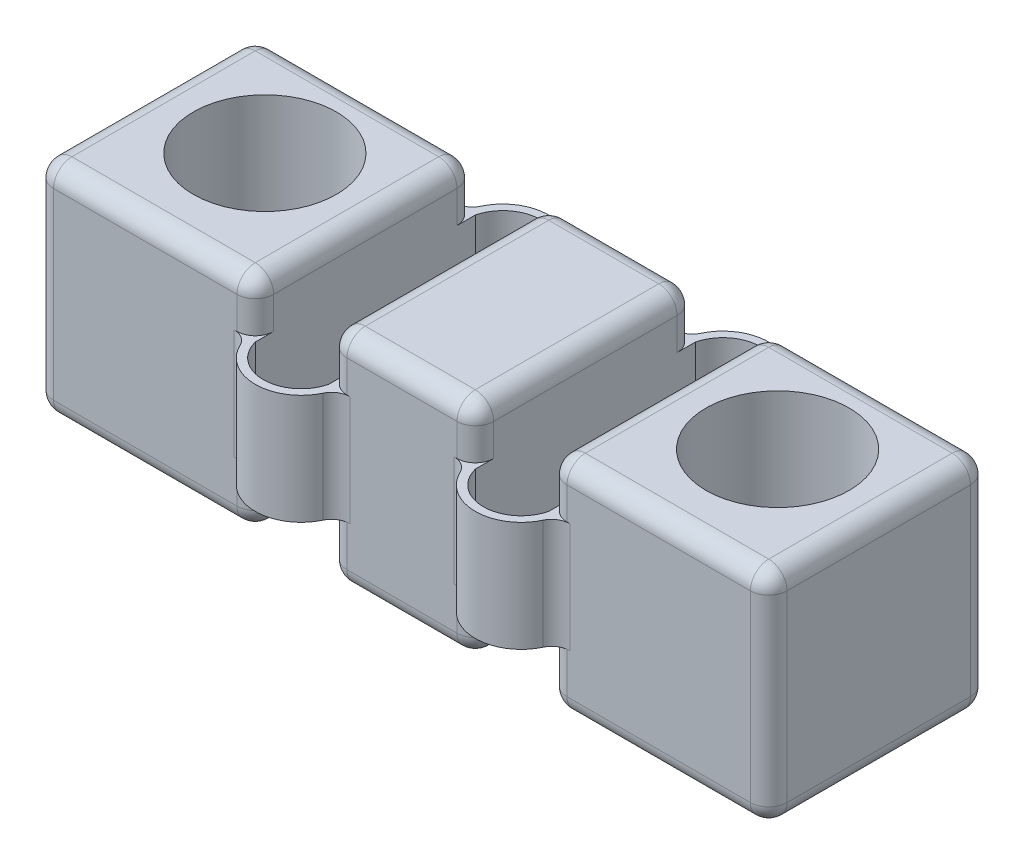
from build123d import *

# Parameters (mm, degrees)
SKETCH_1_W           = 20
SKETCH_1_H           = 6
EXTRUDE_3_DEPTH      = 8
CUT_EXTRUDE_4_DEPTH  = 5
CUT_EXTRUDE_6_DEPTH  = 14.865839901
CUT_EXTRUDE_7_DEPTH  = 14.784466481
HOLE_WIZARD_M3_5_1_D = 3.9
FILLET_4_R           = 0.5
FILLET_5_R           = 0.5
FILLET_6_R           = 0.5
FILLET_7_R           = 0.5
FILLET_8_R           = 0.5
FILLET_9_R           = 0.5
FILLET_10_R          = 0.5
FILLET_11_R          = 0.5
FILLET_12_R          = 0.5
FILLET_13_R          = 0.5
FILLET_14_R          = 0.5
FILLET_15_R          = 0.5
FILLET_16_R          = 0.5
FILLET_18_R          = 0.5
FILLET_19_R          = 0.5
FILLET_20_R          = 0.5


with BuildPart() as part:
    # 草图1 → 凸台-拉伸3 (new body)
    with BuildSketch(Plane.XY):
        with Locations((-0.337837838, 1.375)):
            Rectangle(SKETCH_1_W, SKETCH_1_H)
    extrude(amount=EXTRUDE_3_DEPTH)

    # 草图4 → 切除-拉伸4 (cut, symmetric)
    with BuildSketch(Plane(origin=(0, 0, 0), x_dir=(1, 0, 0), z_dir=(0, 1, 0))):
        with BuildLine():
            Line((-10.337837838, -1), (-4.562582709, -1))
            ThreePointArc((-4.562582709, -1), (-4.477957321, -0.737527987), (-4.337837838, -0.5))
            Line((-4.337837838, -0.5), (-4.337837838, 0))
            Line((-4.337837838, 0), (-10.337837838, 0))
            Line((-10.337837838, 0), (-10.337837838, -1))
        make_face()
        with BuildLine():
            Line((-10.337837838, -8), (-4.337837838, -8))
            Line((-4.337837838, -8), (-4.337837838, -7.5))
            ThreePointArc((-4.337837838, -7.5), (-4.477957321, -7.262472013), (-4.562582709, -7))
            Line((-4.562582709, -7), (-10.337837838, -7))
            Line((-10.337837838, -7), (-10.337837838, -8))
        make_face()
        with BuildLine():
            Line((-4.337837838, -8), (-3.337837838, -8))
            ThreePointArc((-3.337837838, -8), (-3.896854832, -7.868033989), (-4.337837838, -7.5))
            Line((-4.337837838, -7.5), (-4.337837838, -8))
        make_face()
        with BuildLine():
            Line((-3.337837838, -8), (-2.337837838, -8))
            Line((-2.337837838, -8), (-2.337837838, -7.5))
            ThreePointArc((-2.337837838, -7.5), (-2.778820843, -7.868033989), (-3.337837838, -8))
        make_face()
        with BuildLine():
            Line((-0.337837838, -8), (1.662162162, -8))
            Line((1.662162162, -8), (1.662162162, -7.5))
            ThreePointArc((1.662162162, -7.5), (1.522042679, -7.262472013), (1.437417291, -7))
            Line((1.437417291, -7), (-2.113092966, -7))
            ThreePointArc((-2.113092966, -7), (-2.197718355, -7.262472013), (-2.337837838, -7.5))
            Line((-2.337837838, -7.5), (-2.337837838, -8))
            Line((-2.337837838, -8), (-0.337837838, -8))
        make_face()
        with BuildLine():
            Line((1.662162162, -8), (2.662162162, -8))
            ThreePointArc((2.662162162, -8), (2.103145168, -7.868033989), (1.662162162, -7.5))
            Line((1.662162162, -7.5), (1.662162162, -8))
        make_face()
        with BuildLine():
            Line((2.662162162, -8), (3.662162162, -8))
            Line((3.662162162, -8), (3.662162162, -7.5))
            ThreePointArc((3.662162162, -7.5), (3.221179157, -7.868033989), (2.662162162, -8))
        make_face()
        with BuildLine():
            Line((3.662162162, -8), (9.662162162, -8))
            Line((9.662162162, -8), (9.662162162, -7))
            Line((9.662162162, -7), (3.886907034, -7))
            ThreePointArc((3.886907034, -7), (3.802281645, -7.262472013), (3.662162162, -7.5))
            Line((3.662162162, -7.5), (3.662162162, -8))
        make_face()
        with BuildLine():
            ThreePointArc((3.662162162, -0.5), (3.802281645, -0.737527987), (3.886907034, -1))
            Line((3.886907034, -1), (9.662162162, -1))
            Line((9.662162162, -1), (9.662162162, 0))
            Line((9.662162162, 0), (3.662162162, 0))
            Line((3.662162162, 0), (3.662162162, -0.5))
        make_face()
        with BuildLine():
            ThreePointArc((2.662162162, 0), (3.221179157, -0.131966011), (3.662162162, -0.5))
            Line((3.662162162, -0.5), (3.662162162, 0))
            Line((3.662162162, 0), (2.662162162, 0))
        make_face()
        with BuildLine():
            Line((1.662162162, 0), (1.662162162, -0.5))
            ThreePointArc((1.662162162, -0.5), (2.103145168, -0.131966011), (2.662162162, 0))
            Line((2.662162162, 0), (1.662162162, 0))
        make_face()
        with BuildLine():
            Line((-2.113092966, -1), (1.437417291, -1))
            ThreePointArc((1.437417291, -1), (1.522042679, -0.737527987), (1.662162162, -0.5))
            Line((1.662162162, -0.5), (1.662162162, 0))
            Line((1.662162162, 0), (-2.337837838, 0))
            Line((-2.337837838, 0), (-2.337837838, -0.5))
            ThreePointArc((-2.337837838, -0.5), (-2.197718355, -0.737527987), (-2.113092966, -1))
        make_face()
        with BuildLine():
            ThreePointArc((-3.337837838, 0), (-2.778820843, -0.131966011), (-2.337837838, -0.5))
            Line((-2.337837838, -0.5), (-2.337837838, 0))
            Line((-2.337837838, 0), (-3.337837838, 0))
        make_face()
        with BuildLine():
            ThreePointArc((-4.337837838, -0.5), (-3.896854832, -0.131966011), (-3.337837838, 0))
            Line((-3.337837838, 0), (-4.337837838, 0))
            Line((-4.337837838, 0), (-4.337837838, -0.5))
        make_face()
        with BuildLine():
            Line((-4.337837838, -1), (-2.337837838, -1))
            ThreePointArc((-2.337837838, -1), (-3.337837838, -0.219223594), (-4.337837838, -1))
        make_face()
        with BuildLine():
            ThreePointArc((-4.337837838, -7), (-3.337837838, -7.780776406), (-2.337837838, -7))
            Line((-2.337837838, -7), (-4.337837838, -7))
        make_face()
        with BuildLine():
            ThreePointArc((1.662162162, -7), (2.662162162, -7.780776406), (3.662162162, -7))
            Line((3.662162162, -7), (2.662162162, -7))
            Line((2.662162162, -7), (1.662162162, -7))
        make_face()
        with BuildLine():
            Line((1.662162162, -1), (3.662162162, -1))
            ThreePointArc((3.662162162, -1), (2.662162162, -0.219223594), (1.662162162, -1))
        make_face()
        with BuildLine():
            ThreePointArc((-4.337837838, -1.5), (-3.337837838, -2.280776406), (-2.337837838, -1.5))
            Line((-2.337837838, -1.5), (-2.337837838, -1))
            Line((-2.337837838, -1), (-4.337837838, -1))
            Line((-4.337837838, -1), (-4.337837838, -1.5))
        make_face()
        with BuildLine():
            ThreePointArc((-4.337837838, -2), (-3.337837838, -2.5), (-2.337837838, -2))
            Line((-2.337837838, -2), (-2.337837838, -1.5))
            ThreePointArc((-2.337837838, -1.5), (-3.337837838, -2.280776406), (-4.337837838, -1.5))
            Line((-4.337837838, -1.5), (-4.337837838, -2))
        make_face()
        with BuildLine():
            ThreePointArc((-4.337837838, -6), (-3.337837838, -5.5), (-2.337837838, -6))
            Line((-2.337837838, -6), (-2.337837838, -2))
            ThreePointArc((-2.337837838, -2), (-3.337837838, -2.5), (-4.337837838, -2))
            Line((-4.337837838, -2), (-4.337837838, -6))
        make_face()
        with BuildLine():
            ThreePointArc((-4.337837838, -6.5), (-3.337837838, -5.719223594), (-2.337837838, -6.5))
            Line((-2.337837838, -6.5), (-2.337837838, -6))
            ThreePointArc((-2.337837838, -6), (-3.337837838, -5.5), (-4.337837838, -6))
            Line((-4.337837838, -6), (-4.337837838, -6.5))
        make_face()
        with BuildLine():
            Line((-4.337837838, -7), (-2.337837838, -7))
            Line((-2.337837838, -7), (-2.337837838, -6.5))
            ThreePointArc((-2.337837838, -6.5), (-3.337837838, -5.719223594), (-4.337837838, -6.5))
            Line((-4.337837838, -6.5), (-4.337837838, -7))
        make_face()
        with BuildLine():
            ThreePointArc((1.662162162, -6), (2.662162162, -5.5), (3.662162162, -6))
            Line((3.662162162, -6), (3.662162162, -2))
            ThreePointArc((3.662162162, -2), (2.662162162, -2.5), (1.662162162, -2))
            Line((1.662162162, -2), (1.662162162, -6))
        make_face()
        with BuildLine():
            ThreePointArc((1.662162162, -6.5), (2.662162162, -5.719223594), (3.662162162, -6.5))
            Line((3.662162162, -6.5), (3.662162162, -6))
            ThreePointArc((3.662162162, -6), (2.662162162, -5.5), (1.662162162, -6))
            Line((1.662162162, -6), (1.662162162, -6.5))
        make_face()
        with BuildLine():
            Line((2.662162162, -7), (3.662162162, -7))
            Line((3.662162162, -7), (3.662162162, -6.5))
            ThreePointArc((3.662162162, -6.5), (2.662162162, -5.719223594), (1.662162162, -6.5))
            Line((1.662162162, -6.5), (1.662162162, -7))
            Line((1.662162162, -7), (2.662162162, -7))
        make_face()
        with BuildLine():
            ThreePointArc((1.662162162, -2), (2.662162162, -2.5), (3.662162162, -2))
            Line((3.662162162, -2), (3.662162162, -1.5))
            ThreePointArc((3.662162162, -1.5), (2.662162162, -2.280776406), (1.662162162, -1.5))
            Line((1.662162162, -1.5), (1.662162162, -2))
        make_face()
        with BuildLine():
            ThreePointArc((1.662162162, -1.5), (2.662162162, -2.280776406), (3.662162162, -1.5))
            Line((3.662162162, -1.5), (3.662162162, -1))
            Line((3.662162162, -1), (1.662162162, -1))
            Line((1.662162162, -1), (1.662162162, -1.5))
        make_face()
    extrude(amount=CUT_EXTRUDE_4_DEPTH, both=True, mode=Mode.SUBTRACT)

    # 草图5 → 切除-拉伸6 (cut, through all)
    with BuildSketch(Plane(origin=(0, 3, 0), x_dir=(1, 0, 0), z_dir=(0, 1, 0))):
        with BuildLine():
            Line((-4.562582709, -7), (-4.337837838, -7))
            ThreePointArc((-4.337837838, -7), (-3.337837838, -7.780776406), (-2.337837838, -7))
            Line((-2.337837838, -7), (-2.113092966, -7))
            ThreePointArc((-2.113092966, -7), (-3.337837838, -8), (-4.562582709, -7))
        make_face()
        with BuildLine():
            Line((-4.562582709, -1), (-4.337837838, -1))
            ThreePointArc((-4.337837838, -1), (-3.337837838, -0.219223594), (-2.337837838, -1))
            Line((-2.337837838, -1), (-2.113092966, -1))
            ThreePointArc((-2.113092966, -1), (-3.337837838, 0), (-4.562582709, -1))
        make_face()
        with BuildLine():
            Line((1.437417291, -1), (1.662162162, -1))
            ThreePointArc((1.662162162, -1), (2.662162162, -0.219223594), (3.662162162, -1))
            Line((3.662162162, -1), (3.886907034, -1))
            ThreePointArc((3.886907034, -1), (2.662162162, 0), (1.437417291, -1))
        make_face()
        with BuildLine():
            Line((1.437417291, -7), (1.662162162, -7))
            ThreePointArc((1.662162162, -7), (2.662162162, -7.780776406), (3.662162162, -7))
            Line((3.662162162, -7), (3.886907034, -7))
            ThreePointArc((3.886907034, -7), (2.662162162, -8), (1.437417291, -7))
        make_face()
    extrude(amount=CUT_EXTRUDE_6_DEPTH, mode=Mode.SUBTRACT)

    # 草图7 → 切除-拉伸7 (cut, through all)
    with BuildSketch(Plane(origin=(0, 0, 0), x_dir=(1, 0, 0), z_dir=(0, 1, 0))):
        with BuildLine():
            Line((-4.562582709, -7), (-4.337837838, -7))
            ThreePointArc((-4.337837838, -7), (-3.337837838, -7.780776406), (-2.337837838, -7))
            Line((-2.337837838, -7), (-2.113092966, -7))
            ThreePointArc((-2.113092966, -7), (-3.337837838, -8), (-4.562582709, -7))
        make_face()
        with BuildLine():
            Line((1.437417291, -7), (1.662162162, -7))
            ThreePointArc((1.662162162, -7), (2.662162162, -7.780776406), (3.662162162, -7))
            Line((3.662162162, -7), (3.886907034, -7))
            ThreePointArc((3.886907034, -7), (2.662162162, -8), (1.437417291, -7))
        make_face()
        with BuildLine():
            Line((1.437417291, -1), (1.662162162, -1))
            ThreePointArc((1.662162162, -1), (2.662162162, -0.219223594), (3.662162162, -1))
            Line((3.662162162, -1), (3.886907034, -1))
            ThreePointArc((3.886907034, -1), (2.662162162, 0), (1.437417291, -1))
        make_face()
        with BuildLine():
            Line((-4.562582709, -1), (-4.337837838, -1))
            ThreePointArc((-4.337837838, -1), (-3.337837838, -0.219223594), (-2.337837838, -1))
            Line((-2.337837838, -1), (-2.113092966, -1))
            ThreePointArc((-2.113092966, -1), (-3.337837838, 0), (-4.562582709, -1))
        make_face()
    extrude(amount=-CUT_EXTRUDE_7_DEPTH, mode=Mode.SUBTRACT)

    # M3.5 间隙孔1 (through all)
    with Locations(Plane(origin=(0, 4.375, 0), x_dir=(1, 0, 0), z_dir=(0, 1, 0))):
        with Locations((-7.291168359, -3.784879217), (6.689336507, -3.784879217)):
            Hole(HOLE_WIZARD_M3_5_1_D / 2)

    # 圆角4
    fillet_4_edges = [part.edges().sort_by_distance(p)[0] for p in [
        (-10.337837838, 1.375, 1),
        (-10.337837838, 4.375, 4),
        (-7.337837838, 4.375, 1),
        (-10.337837838, 1.375, 7),
    ]]
    fillet(fillet_4_edges, radius=FILLET_4_R)

    # 圆角5
    # the kernel refuses this fillet: 0.5 mm, written as the material it takes off along each edge
    with BuildSketch(Plane(origin=(-9.837837838, 3.875, 6.5), x_dir=(0, 0, 1), z_dir=(0, 1, 0))) as fillet_5_piece_1_section:
        Polygon((0, 0), (FILLET_5_R, 0), (FILLET_5_R, -FILLET_5_R), (0, -FILLET_5_R), align=None)
    fillet_5_piece_1 = extrude(amount=FILLET_5_R, mode=Mode.PRIVATE)
    fillet_5_piece_1 = fillet_5_piece_1 - Plane(origin=(-9.837837838, 3.875, 6.5), x_dir=(0.7071067811865475, 0, -0.7071067811865475), z_dir=(0, 1, 0)) * Sphere(FILLET_5_R, mode=Mode.PRIVATE)
    add(fillet_5_piece_1, mode=Mode.SUBTRACT)
    with BuildSketch(Plane(origin=(-9.837837838, -1.625, 7), x_dir=(0, 1, 0), z_dir=(1, 0, 0)), Plane(origin=(-9.837837838, 4.375, 7), x_dir=(0, 0, -1), z_dir=(1, 0, 0)), Plane(origin=(-3.087837838, -1.625, 1), x_dir=(0, 1, 0), z_dir=(-1, 0, 0))) as fillet_5_piece_2:
        with BuildLine():
            CenterArc((FILLET_5_R, -FILLET_5_R), FILLET_5_R, 90, 90)
            Line((0, -FILLET_5_R), (0, 0))
            Line((0, 0), (FILLET_5_R, 0))
        make_face()
    extrude(amount=6.75, mode=Mode.SUBTRACT)
    with BuildSketch(Plane(origin=(-10.337837838, -1.625, 1.5), x_dir=(1, 0, 0), z_dir=(0, 0, 1))) as fillet_5_piece_3:
        with BuildLine():
            CenterArc((FILLET_5_R, FILLET_5_R), FILLET_5_R, 180, 90)
            Line((0, FILLET_5_R), (0, 0))
            Line((0, 0), (FILLET_5_R, 0))
        make_face()
    extrude(amount=5, mode=Mode.SUBTRACT)
    with BuildSketch(Plane(origin=(-9.837837838, -1.625, 1.5), x_dir=(0, 0, -1), z_dir=(1, 0, 0))) as fillet_5_piece_4:
        with BuildLine():
            CenterArc((0.5 - FILLET_5_R, FILLET_5_R), FILLET_5_R, 270, 90)
            Line((0.5, FILLET_5_R), (0.5, 0))
            Line((0.5, 0), (0.5 - FILLET_5_R, 0))
        make_face()
    revolve(axis=Axis((-9.837837838, -1.625, 1.5), (0, 1, 0)), revolution_arc=90, mode=Mode.SUBTRACT)
    with BuildSketch(Plane(origin=(-9.837837838, -1.625, 6.5), x_dir=(-1, 0, 0), z_dir=(0, 0, -1))) as fillet_5_piece_5:
        with BuildLine():
            CenterArc((0.5 - FILLET_5_R, FILLET_5_R), FILLET_5_R, 270, 90)
            Line((0.5, FILLET_5_R), (0.5, 0))
            Line((0.5, 0), (0.5 - FILLET_5_R, 0))
        make_face()
    revolve(axis=Axis((-9.837837838, -1.625, 6.5), (0, 1, 0)), revolution_arc=90, mode=Mode.SUBTRACT)

    # 圆角6
    fillet_6_edges = [part.edges().sort_by_distance(p)[0] for p in [
        (-4.562582709, 1.5, 7),
    ]]
    fillet(fillet_6_edges, radius=FILLET_6_R)

    # 圆角7
    fillet_7_edges = [part.edges().sort_by_distance(p)[0] for p in [
        (-2.113092966, 1.5, 7),
    ]]
    fillet(fillet_7_edges, radius=FILLET_7_R)

    # 圆角8
    fillet_8_edges = [part.edges().sort_by_distance(p)[0] for p in [
        (1.437417291, 1.5, 7),
    ]]
    fillet(fillet_8_edges, radius=FILLET_8_R)

    # 圆角9
    fillet_9_edges = [part.edges().sort_by_distance(p)[0] for p in [
        (3.886907034, 1.5, 7),
    ]]
    fillet(fillet_9_edges, radius=FILLET_9_R)

    # 圆角10
    fillet_10_edges = [part.edges().sort_by_distance(p)[0] for p in [
        (-4.562582709, 1.5, 1),
    ]]
    fillet(fillet_10_edges, radius=FILLET_10_R)

    # 圆角11
    fillet_11_edges = [part.edges().sort_by_distance(p)[0] for p in [
        (3.886907034, 1.5, 1),
        (-2.113092966, 1.5, 1),
    ]]
    fillet(fillet_11_edges, radius=FILLET_11_R)

    # 圆角12
    fillet_12_edges = [part.edges().sort_by_distance(p)[0] for p in [
        (1.437417291, 1.5, 1),
    ]]
    fillet(fillet_12_edges, radius=FILLET_12_R)

    # 圆角13
    fillet_13_edges = [part.edges().sort_by_distance(p)[0] for p in [
        (-4.337837838, 4.375, 4),
        (-4.337837838, 3.4375, 1),
        (-4.337837838, 4.228553391, 1.146446609),
        (-4.337837838, -1.625, 4),
        (-4.337837838, 3.4375, 7),
        (-4.337837838, -0.5625, 7),
        (-4.337837838, -0.5625, 1),
        (-4.337837838, 4.228553391, 6.853553391),
        (-4.337837838, -1.478553391, 6.853553391),
        (-4.337837838, -1.478553391, 1.146446609),
    ]]
    fillet(fillet_13_edges, radius=FILLET_13_R)

    # 圆角14
    fillet_14_edges = [part.edges().sort_by_distance(p)[0] for p in [
        (9.662162162, 4.375, 4),
        (9.662162162, -1.625, 4),
        (6.662162162, 4.375, 7),
        (9.662162162, 1.375, 7),
        (9.662162162, 1.375, 1),
        (6.662162162, 4.375, 1),
        (3.662162162, 4.375, 4),
    ]]
    fillet(fillet_14_edges, radius=FILLET_14_R)

    # 圆角15
    # the kernel refuses this fillet: 0.5 mm, written as the material it takes off along each edge
    with BuildSketch(Plane(origin=(4.162162162, 3.875, 1.5), x_dir=(0, 0, -1), z_dir=(-1, 0, 0))) as fillet_15_piece_1_section:
        Polygon((0, 0), (FILLET_15_R * 1.02, 0), (FILLET_15_R * 1.02, -FILLET_15_R * 1.02), (0, -FILLET_15_R * 1.02), align=None)
    fillet_15_piece_1 = extrude(amount=FILLET_15_R * 1.02, mode=Mode.PRIVATE)
    fillet_15_piece_1 = fillet_15_piece_1 - Plane(origin=(4.162162162, 3.875, 1.5), x_dir=(0, -0.7071067811865475, 0.7071067811865475), z_dir=(-1, 0, 0)) * Sphere(FILLET_15_R, mode=Mode.PRIVATE)
    add(fillet_15_piece_1, mode=Mode.SUBTRACT)
    with BuildSketch(Plane(origin=(9.162162162, -1.125, 6.5), x_dir=(0, -1, 0), z_dir=(0, 0, 1))) as fillet_15_piece_2_section:
        Polygon((0, 0), (FILLET_15_R * 1.02, 0), (FILLET_15_R * 1.02, FILLET_15_R * 1.02), (0, FILLET_15_R * 1.02), align=None)
    fillet_15_piece_2 = extrude(amount=FILLET_15_R * 1.02, mode=Mode.PRIVATE)
    fillet_15_piece_2 = fillet_15_piece_2 - Plane(origin=(9.162162162, -1.125, 6.5), x_dir=(-0.7071067811865475, 0.7071067811865475, 0), z_dir=(0, 0, 1)) * Sphere(FILLET_15_R, mode=Mode.PRIVATE)
    add(fillet_15_piece_2, mode=Mode.SUBTRACT)
    with BuildSketch(Plane(origin=(9.162162162, -1.125, 1.5), x_dir=(0, 0, -1), z_dir=(0, -1, 0))) as fillet_15_piece_3_section:
        Polygon((0, 0), (FILLET_15_R * 1.02, 0), (FILLET_15_R * 1.02, FILLET_15_R * 1.02), (0, FILLET_15_R * 1.02), align=None)
    fillet_15_piece_3 = extrude(amount=FILLET_15_R * 1.02, mode=Mode.PRIVATE)
    fillet_15_piece_3 = fillet_15_piece_3 - Plane(origin=(9.162162162, -1.125, 1.5), x_dir=(-0.7071067811865475, 0, 0.7071067811865475), z_dir=(0, -1, 0)) * Sphere(FILLET_15_R, mode=Mode.PRIVATE)
    add(fillet_15_piece_3, mode=Mode.SUBTRACT)
    with BuildSketch(Plane(origin=(3.662162162, 3, 1), x_dir=(0, 0, 1), z_dir=(0, 1, 0))) as fillet_15_piece_4:
        with BuildLine():
            CenterArc((FILLET_15_R, FILLET_15_R), FILLET_15_R, 180, 90)
            Line((0, FILLET_15_R), (0, 0))
            Line((0, 0), (FILLET_15_R, 0))
        make_face()
    extrude(amount=0.875, mode=Mode.SUBTRACT)
    with BuildSketch(Plane(origin=(3.662162162, -1.625, -0.25), x_dir=(0, 1, 0), z_dir=(0, 0, 1))) as fillet_15_piece_5:
        with BuildLine():
            CenterArc((FILLET_15_R, -FILLET_15_R), FILLET_15_R, 90, 90)
            Line((0, -FILLET_15_R), (0, 0))
            Line((0, 0), (FILLET_15_R, 0))
        make_face()
    extrude(amount=8.5, mode=Mode.SUBTRACT)
    with BuildSketch(Plane(origin=(2.412162162, -1.625, 7), x_dir=(0, 1, 0), z_dir=(1, 0, 0))) as fillet_15_piece_6:
        with BuildLine():
            CenterArc((FILLET_15_R, -FILLET_15_R), FILLET_15_R, 90, 90)
            Line((0, -FILLET_15_R), (0, 0))
            Line((0, 0), (FILLET_15_R, 0))
        make_face()
    extrude(amount=6.75, mode=Mode.SUBTRACT)
    with BuildSketch(Plane(origin=(9.162162162, -1.625, 1), x_dir=(0, 0, 1), z_dir=(-1, 0, 0))) as fillet_15_piece_7:
        with BuildLine():
            CenterArc((FILLET_15_R, FILLET_15_R), FILLET_15_R, 180, 90)
            Line((0, FILLET_15_R), (0, 0))
            Line((0, 0), (FILLET_15_R, 0))
        make_face()
    extrude(amount=6.75, mode=Mode.SUBTRACT)

    # 圆角16
    # the kernel refuses this fillet: 0.5 mm, written as the material it takes off along each edge
    with BuildSketch(Plane(origin=(4.162162162, 3.875, 6.5), x_dir=(-1, 0, 0), z_dir=(0, 0, 1))) as fillet_16_piece_1_section:
        Polygon((0, 0), (FILLET_16_R * 1.02, 0), (FILLET_16_R * 1.02, -FILLET_16_R * 1.02), (0, -FILLET_16_R * 1.02), align=None)
    fillet_16_piece_1 = extrude(amount=FILLET_16_R * 1.02, mode=Mode.PRIVATE)
    fillet_16_piece_1 = fillet_16_piece_1 - Plane(origin=(4.162162162, 3.875, 6.5), x_dir=(0.7071067811865475, -0.7071067811865475, 0), z_dir=(0, 0, 1)) * Sphere(FILLET_16_R, mode=Mode.PRIVATE)
    add(fillet_16_piece_1, mode=Mode.SUBTRACT)
    with BuildSketch(Plane(origin=(4.162162162, -1.125, 1.5), x_dir=(0, 0, -1), z_dir=(-1, 0, 0))) as fillet_16_piece_2_section:
        Polygon((0, 0), (FILLET_16_R * 1.02, 0), (FILLET_16_R * 1.02, FILLET_16_R * 1.02), (0, FILLET_16_R * 1.02), align=None)
    fillet_16_piece_2 = extrude(amount=FILLET_16_R * 1.02, mode=Mode.PRIVATE)
    fillet_16_piece_2 = fillet_16_piece_2 - Plane(origin=(4.162162162, -1.125, 1.5), x_dir=(0, 0.7071067811865475, 0.7071067811865475), z_dir=(-1, 0, 0)) * Sphere(FILLET_16_R, mode=Mode.PRIVATE)
    add(fillet_16_piece_2, mode=Mode.SUBTRACT)
    with BuildSketch(Plane(origin=(4.162162162, -1.125, 6.5), x_dir=(-1, 0, 0), z_dir=(0, 0, 1))) as fillet_16_piece_3_section:
        Polygon((0, 0), (FILLET_16_R * 1.02, 0), (FILLET_16_R * 1.02, FILLET_16_R * 1.02), (0, FILLET_16_R * 1.02), align=None)
    fillet_16_piece_3 = extrude(amount=FILLET_16_R * 1.02, mode=Mode.PRIVATE)
    fillet_16_piece_3 = fillet_16_piece_3 - Plane(origin=(4.162162162, -1.125, 6.5), x_dir=(0.7071067811865475, 0.7071067811865475, 0), z_dir=(0, 0, 1)) * Sphere(FILLET_16_R, mode=Mode.PRIVATE)
    add(fillet_16_piece_3, mode=Mode.SUBTRACT)
    with BuildSketch(Plane(origin=(3.662162162, 3, 7), x_dir=(1, 0, 0), z_dir=(0, 1, 0))) as fillet_16_piece_4:
        with BuildLine():
            CenterArc((FILLET_16_R, FILLET_16_R), FILLET_16_R, 180, 90)
            Line((0, FILLET_16_R), (0, 0))
            Line((0, 0), (FILLET_16_R, 0))
        make_face()
    extrude(amount=0.875, mode=Mode.SUBTRACT)
    with BuildSketch(Plane(origin=(3.662162162, -1.125, 1), x_dir=(0, 0, 1), z_dir=(0, 1, 0)), Plane(origin=(3.662162162, -1.125, 7), x_dir=(1, 0, 0), z_dir=(0, 1, 0))) as fillet_16_piece_5:
        with BuildLine():
            CenterArc((FILLET_16_R, FILLET_16_R), FILLET_16_R, 180, 90)
            Line((0, FILLET_16_R), (0, 0))
            Line((0, 0), (FILLET_16_R, 0))
        make_face()
    extrude(amount=1.125, mode=Mode.SUBTRACT)

    # 圆角18
    fillet_18_edges = [part.edges().sort_by_distance(p)[0] for p in [
        (-2.337837838, 3.6875, 7),
        (-2.337837838, 3.6875, 1),
        (-2.337837838, -0.8125, 7),
        (-2.337837838, -0.8125, 1),
        (1.662162162, -0.8125, 1),
    ]]
    fillet(fillet_18_edges, radius=FILLET_18_R)

    # 圆角19
    fillet_19_edges = [part.edges().sort_by_distance(p)[0] for p in [
        (1.662162162, -0.8125, 7),
    ]]
    fillet(fillet_19_edges, radius=FILLET_19_R)

    # 圆角20
    fillet_20_edges = [part.edges().sort_by_distance(p)[0] for p in [
        (-0.087837838, 4.375, 7),
        (1.662162162, 3.6875, 1),
        (1.662162162, 3.6875, 7),
        (-0.087837838, 4.375, 1),
        (-0.337837838, -1.625, 1),
        (-2.337837838, -1.625, 4),
        (-0.337837838, -1.625, 7),
        (-2.191391228, -1.625, 6.853553391),
        (-2.191391228, -1.625, 1.146446609),
        (1.515715553, -1.625, 1.146446609),
        (-2.337837838, 4.375, 4),
        (-2.191391228, 4.375, 6.853553391),
        (-2.191391228, 4.375, 1.146446609),
        (1.662162162, -1.625, 4),
        (1.515715553, -1.625, 6.853553391),
        (1.662162162, 4.375, 4),
    ]]
    fillet(fillet_20_edges, radius=FILLET_20_R)


solid = part.part
